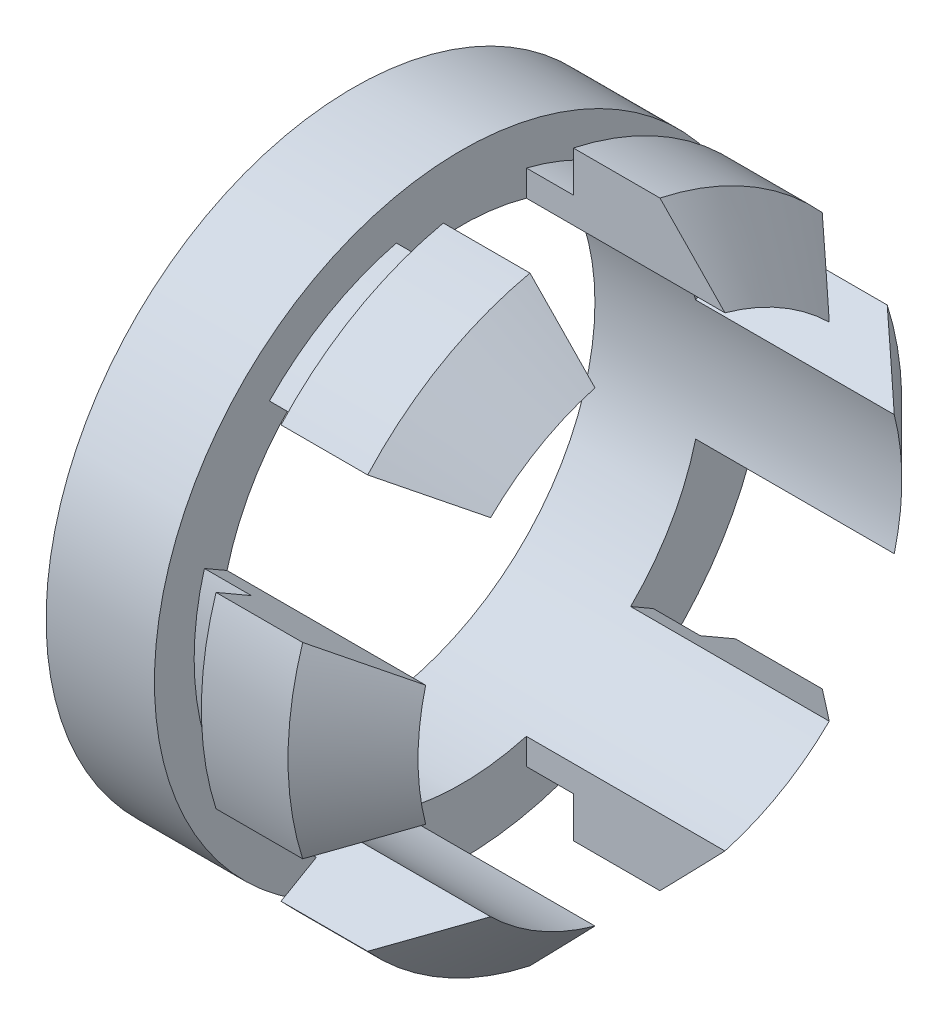
from build123d import *

# Parameters (mm, degrees)
SKETCH_1_R               = 8.5
SKETCH_1_R_2             = 6.7
EXTRUDE_1_DEPTH          = 8.5
SKETCH_2_W               = 1.3
SKETCH_2_H               = 1.1
SKETCH_4_W               = 3.6
SKETCH_4_H               = 17
CUT_EXTRUDE_1_DEPTH      = 8.5
PATTERN_START            = 3
PATTERN_CIRCULAR_1_DEPTH = 5.5000001


# Read off the part's stored shape, not the designer's step: Круговой массив1
with BuildPart() as part:
    # Эскиз1 → Вытянуть1 (new body)
    with BuildSketch(Plane(origin=(0, 0, 0), x_dir=(0, 0, -1), z_dir=(1, 0, 0))):
        Circle(SKETCH_1_R)
        Circle(SKETCH_1_R_2, mode=Mode.SUBTRACT)
    extrude(amount=EXTRUDE_1_DEPTH)

    # Эскиз2 → Вырез-Повернуть1 (revolve, cut)
    with BuildSketch(Plane.XY, mode=Mode.PRIVATE) as cut_revolve_1_sk:
        with Locations((3.65, 7.95)):
            Rectangle(SKETCH_2_W, SKETCH_2_H)
    revolve(cut_revolve_1_sk.sketch.rotate(Axis((8.5, 0, 0), (-1, 0, 0)), 90), axis=Axis((8.5, 0, 0), (-1, 0, 0)), mode=Mode.SUBTRACT)

    # Эскиз3 → Вырез-Повернуть2 (revolve, cut)
    with BuildSketch(Plane.XY, mode=Mode.PRIVATE) as cut_revolve_2_sk:
        Polygon((8.5, 6.7), (6.7, 8.5), (8.5, 8.5), align=None)
    revolve(cut_revolve_2_sk.sketch.rotate(Axis((8.5, 0, 0), (-1, 0, 0)), 90), axis=Axis((8.5, 0, 0), (-1, 0, 0)), mode=Mode.SUBTRACT)

    # Эскиз4 → Вырез-Вытянуть1 (cut)
    with BuildSketch(Plane(origin=(3, 0, 0), x_dir=(0, 0, -1), z_dir=(1, 0, 0))):
        Rectangle(SKETCH_4_W, SKETCH_4_H)
    extrude(amount=CUT_EXTRUDE_1_DEPTH, mode=Mode.SUBTRACT)

    # Круговой массив1 outline → Круговой массив1 (cut)
    with BuildSketch(Plane.YZ.offset(PATTERN_START)):
        with BuildLine():
            ThreePointArc((4.785686287, -4.689051798), (3.35, -5.802370205), (1.667994833, -6.489051798))
            Line((1.667994833, -6.489051798), (2.594767158, -8.094268552))
            ThreePointArc((2.594767158, -8.094268552), (4.25, -7.361215932), (5.712458612, -6.294268552))
            Line((5.712458612, -6.294268552), (4.785686287, -4.689051798))
        make_face()
        with BuildLine():
            ThreePointArc((-1.667994833, -6.489051798), (-3.35, -5.802370205), (-4.785686287, -4.689051798))
            Line((-4.785686287, -4.689051798), (-5.712458612, -6.294268552))
            ThreePointArc((-5.712458612, -6.294268552), (-4.25, -7.361215932), (-2.594767158, -8.094268552))
            Line((-2.594767158, -8.094268552), (-1.667994833, -6.489051798))
        make_face()
        with BuildLine():
            ThreePointArc((1.667994833, 6.489051798), (3.35, 5.802370205), (4.785686287, 4.689051798))
            Line((4.785686287, 4.689051798), (5.712458612, 6.294268552))
            ThreePointArc((5.712458612, 6.294268552), (4.25, 7.361215932), (2.594767158, 8.094268552))
            Line((2.594767158, 8.094268552), (1.667994833, 6.489051798))
        make_face()
        with BuildLine():
            ThreePointArc((-4.785686287, 4.689051798), (-3.35, 5.802370205), (-1.667994833, 6.489051798))
            Line((-1.667994833, 6.489051798), (-2.594767158, 8.094268552))
            ThreePointArc((-2.594767158, 8.094268552), (-4.25, 7.361215932), (-5.712458612, 6.294268552))
            Line((-5.712458612, 6.294268552), (-4.785686287, 4.689051798))
        make_face()
    extrude(amount=PATTERN_CIRCULAR_1_DEPTH, mode=Mode.SUBTRACT)


solid = part.part
